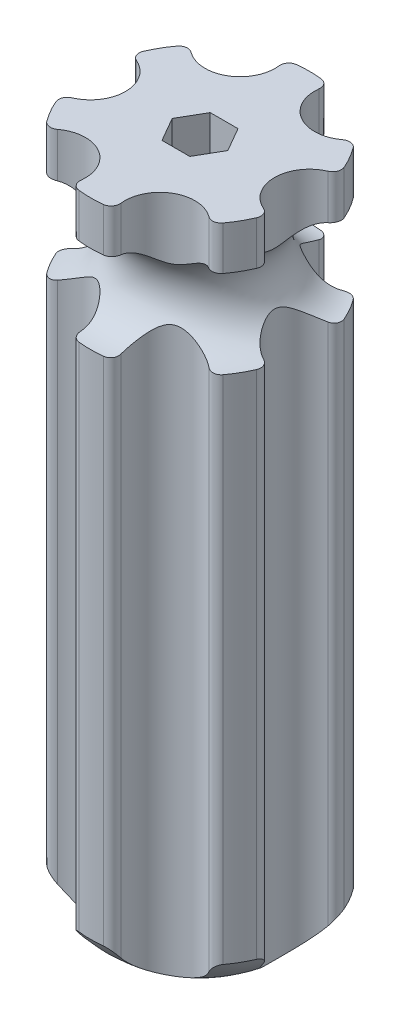
from build123d import *

# Parameters (mm, degrees)
SKETCH2_R          = 4
CUT_EXTRUDE1_DEPTH = 80
FILLET1_R          = 1
CUT_EXTRUDE3_DEPTH = 75


with BuildPart() as part:
    # Sketch1 → Revolve1 (revolve)
    with BuildSketch(Plane.XY, mode=Mode.PRIVATE) as revolve1_sk:
        with BuildLine():
            Line((-6.25, 35), (-6.25, 40))
            Line((-6.25, 40), (6.25, 40))
            Line((6.25, 40), (6.25, -40))
            ThreePointArc((6.25, -40), (-0.843185827, -38.216910184), (-6.25, -33.291561976))
            Line((-6.25, -33.291561976), (-6.25, 25))
            ThreePointArc((-6.25, 25), (-1.25, 30), (-6.25, 35))
        make_face()
    revolve(revolve1_sk.sketch.rotate(Axis((6.25, -40, 0), (0, 1, 0)), 270), axis=Axis((6.25, -40, 0), (0, 1, 0)))

    # Sketch2 → Cut-Extrude1 (cut)
    with BuildSketch(Plane(origin=(0, 40, 0), x_dir=(1, 0, 0), z_dir=(0, 1, 0))):
        with Locations((18.75, 0)):
            Circle(SKETCH2_R)
        with Locations((12.5, -10.825317547)):
            Circle(SKETCH2_R)
        with Locations((0, -10.825317547)):
            Circle(SKETCH2_R)
        with Locations((-6.25, 0)):
            Circle(SKETCH2_R)
        with Locations((0, 10.825317547)):
            Circle(SKETCH2_R)
        with Locations((12.5, 10.825317547)):
            Circle(SKETCH2_R)
    extrude(amount=-CUT_EXTRUDE1_DEPTH, mode=Mode.SUBTRACT)

    # Fillet1
    # the kernel refuses this fillet: 1 mm, written as the material it takes off along each edge
    with BuildSketch(Plane(origin=(15.599473644, 32.184732909, 8.29682726), x_dir=(-0.7210706892496556, 0, -0.6928615021092069), z_dir=(0, 1, 0)), Plane(origin=(3.739473644, 32.184732909, 12.245295318), x_dir=(0.23950031750599202, 0, -0.9708962858691597), z_dir=(0, 1, 0)), Plane(origin=(-5.61, 32.184732909, 3.948468057), x_dir=(0.9605710067556473, 0, -0.27803478375995005), z_dir=(0, 1, 0)), Plane(origin=(-3.099473644, 32.184732909, -8.29682726), x_dir=(0.7210706892496521, 0, 0.6928615021092106), z_dir=(0, 1, 0)), Plane(origin=(18.11, 32.184732909, -3.948468057), x_dir=(-0.9605710067556453, 0, 0.27803478375995666), z_dir=(0, 1, 0))) as fillet1_piece_1:
        with BuildLine():
            CenterArc((1.086853541, -0.99268155), FILLET1_R, 96.936053195, 90.498230449)
            ThreePointArc((0.095259623, -1.122070502), (0.034987683, -0.562108521), (0, 0))
            ThreePointArc((0, 0), (0.483046018, -0.029273801), (0.966092036, 0))
        make_face()
    extrude(amount=10.630534182, mode=Mode.SUBTRACT)
    with BuildSketch(Plane(origin=(8.760526356, 32.184732909, 12.245295318), x_dir=(-0.9876760860469396, 0, 0.1565118176081232), z_dir=(0, 1, 0)), Plane(origin=(-3.099473644, 32.184732909, 8.29682726), x_dir=(-0.6293812530645806, 0, -0.7770966724229735), z_dir=(0, 1, 0)), Plane(origin=(-5.61, 32.184732909, -3.948468057), x_dir=(0.3582948329823615, 0, -0.9336084900310953), z_dir=(0, 1, 0)), Plane(origin=(3.739473644, 32.184732909, -12.245295318), x_dir=(0.9876760860469406, 0, -0.15651181760811697), z_dir=(0, 1, 0)), Plane(origin=(15.599473644, 32.184732909, -8.29682726), x_dir=(0.6293812530645756, 0, 0.7770966724229779), z_dir=(0, 1, 0)), Plane(origin=(18.11, 32.184732909, 3.948468057), x_dir=(-0.35829483298235226, 0, 0.9336084900310988), z_dir=(0, 1, 0))) as fillet1_piece_2:
        with BuildLine():
            CenterArc((1.081062563, -0.998984992), FILLET1_R, 87.418279691, 90.498230449)
            ThreePointArc((0.081723652, -0.962629247), (0.0700307, -0.478838294), (0, 0))
            ThreePointArc((0, 0), (0.563053418, 0.012687605), (1.126106836, 0))
        make_face()
    extrude(amount=10.630534182, mode=Mode.SUBTRACT)
    with BuildSketch(Plane(origin=(8.760526356, 32.184732909, -12.245295318), x_dir=(-0.9876760860469377, 0, -0.15651181760813523), z_dir=(0, 1, 0))) as fillet1_piece_3:
        with BuildLine():
            CenterArc((1.081062563, 0.998984992), FILLET1_R, 182.08348986, 90.498230449)
            ThreePointArc((0.081723652, 0.962629247), (0.0700307, 0.478838294), (0, 0))
            ThreePointArc((0, 0), (0.563053418, -0.012687605), (1.126106836, 0))
        make_face()
    extrude(amount=10.630534182, mode=Mode.SUBTRACT)
    with BuildSketch(Plane(origin=(3.739473644, -36.106829067, -12.245295318), x_dir=(0.23950031750597817, 0, 0.9708962858691631), z_dir=(0, 1, 0)), Plane(origin=(-5.61, -36.106829067, -3.948468057), x_dir=(0.9605710067556431, 0, 0.2780347837599646), z_dir=(0, 1, 0)), Plane(origin=(-3.099473644, -36.106829067, 8.29682726), x_dir=(0.7210706892496622, 0, -0.6928615021092001), z_dir=(0, 1, 0)), Plane(origin=(8.760526356, -36.106829067, 12.245295318), x_dir=(-0.23950031750598383, 0, -0.9708962858691618), z_dir=(0, 1, 0)), Plane(origin=(18.11, -36.106829067, 3.948468057), x_dir=(-0.9605710067556452, 0, -0.27803478375995727), z_dir=(0, 1, 0)), Plane(origin=(15.599473644, -36.106829067, -8.29682726), x_dir=(-0.721070689249666, 0, 0.6928615021091961), z_dir=(0, 1, 0))) as fillet1_piece_4:
        with BuildLine():
            CenterArc((1.086853541, 0.99268155), FILLET1_R, 172.565716356, 90.498230449)
            ThreePointArc((0.095259623, 1.122070502), (0.034987683, 0.562108521), (0, 0))
            ThreePointArc((0, 0), (0.483046018, 0.029273801), (0.966092036, 0))
        make_face()
    extrude(amount=63.922096158, mode=Mode.SUBTRACT)
    with BuildSketch(Plane(origin=(-3.099473644, -36.106829067, -8.29682726), x_dir=(-0.6293812530645909, 0, 0.7770966724229651), z_dir=(0, 1, 0)), Plane(origin=(-5.61, -36.106829067, 3.948468057), x_dir=(0.35829483298234877, 0, 0.9336084900311001), z_dir=(0, 1, 0)), Plane(origin=(3.739473644, -36.106829067, 12.245295318), x_dir=(0.9876760860469385, 0, 0.15651181760813046), z_dir=(0, 1, 0)), Plane(origin=(15.599473644, -36.106829067, 8.29682726), x_dir=(0.6293812530645854, 0, -0.7770966724229696), z_dir=(0, 1, 0)), Plane(origin=(18.11, -36.106829067, -3.948468057), x_dir=(-0.3582948329823554, 0, -0.9336084900310977), z_dir=(0, 1, 0))) as fillet1_piece_5:
        with BuildLine():
            CenterArc((1.081062563, 0.998984992), FILLET1_R, 182.08348986, 90.498230449)
            ThreePointArc((0.081723652, 0.962629247), (0.0700307, 0.478838294), (0, 0))
            ThreePointArc((0, 0), (0.563053418, -0.012687605), (1.126106836, 0))
        make_face()
    extrude(amount=63.922096158, mode=Mode.SUBTRACT)
    with BuildSketch(Plane(origin=(8.760526356, -36.106829067, -12.245295318), x_dir=(-0.23950031750599937, 0, 0.9708962858691579), z_dir=(0, 1, 0))) as fillet1_piece_6:
        with BuildLine():
            CenterArc((1.086853541, -0.99268155), FILLET1_R, 96.936053195, 90.498230449)
            ThreePointArc((0.095259623, -1.122070502), (0.034987683, -0.562108521), (0, 0))
            ThreePointArc((0, 0), (0.483046018, -0.029273801), (0.966092036, 0))
        make_face()
    extrude(amount=63.922096158, mode=Mode.SUBTRACT)

    # Sketch3 → Cut-Extrude3 (cut)
    with BuildSketch(Plane(origin=(0, 0, 0), x_dir=(1, 0, 0), z_dir=(0, 1, 0))):
        Polygon((9.425, 0), (7.8375, 2.749630657), (4.6625, 2.749630657), (3.075, 0), (4.6625, -2.749630657), (7.8375, -2.749630657), align=None)
    extrude(amount=CUT_EXTRUDE3_DEPTH, mode=Mode.SUBTRACT)


solid = part.part
